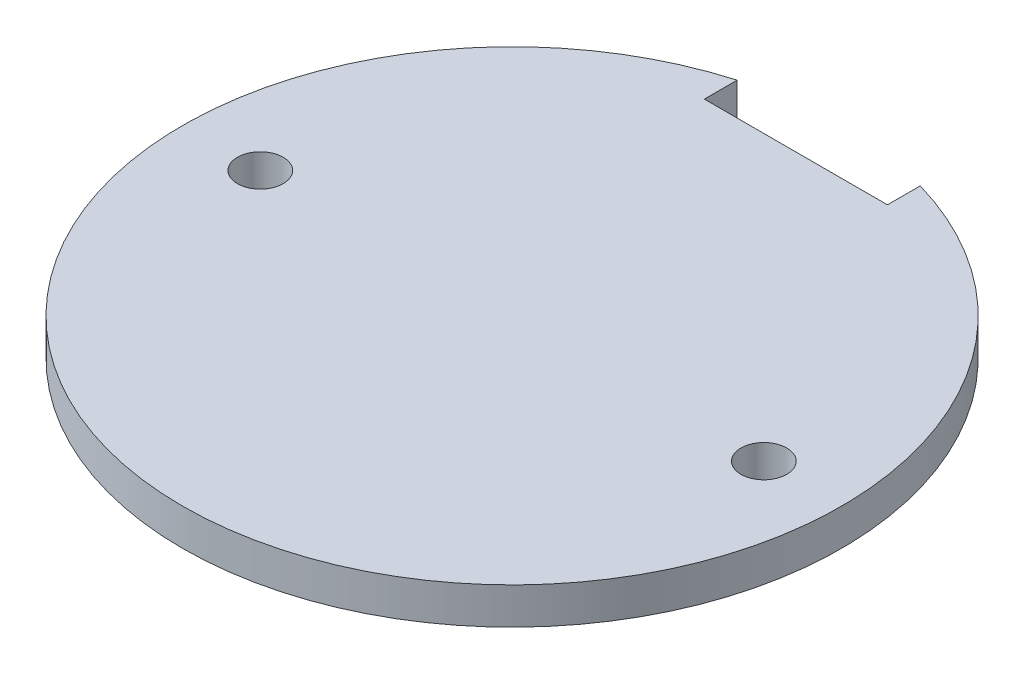
from build123d import *

# Parameters (mm, degrees)
SKETCH1_R           = 2.5
BOSS_EXTRUDE1_DEPTH = 4


with BuildPart() as part:
    # Sketch1 → Boss-Extrude1 (new body)
    with BuildSketch(Plane(origin=(0, 0, 0), x_dir=(1, 0, 0), z_dir=(0, 1, 0))):
        with BuildLine():
            Line((-10, 34.583232932), (-10, 31))
            Line((-10, 31), (10, 31))
            Line((10, 31), (10, 34.583232932))
            ThreePointArc((10, 34.583232932), (0, -36), (-10, 34.583232932))
        make_face()
        with Locations((-27.5, 0)):
            Circle(SKETCH1_R, mode=Mode.SUBTRACT)
        with Locations((27.5, 0)):
            Circle(SKETCH1_R, mode=Mode.SUBTRACT)
    extrude(amount=BOSS_EXTRUDE1_DEPTH)


solid = part.part
